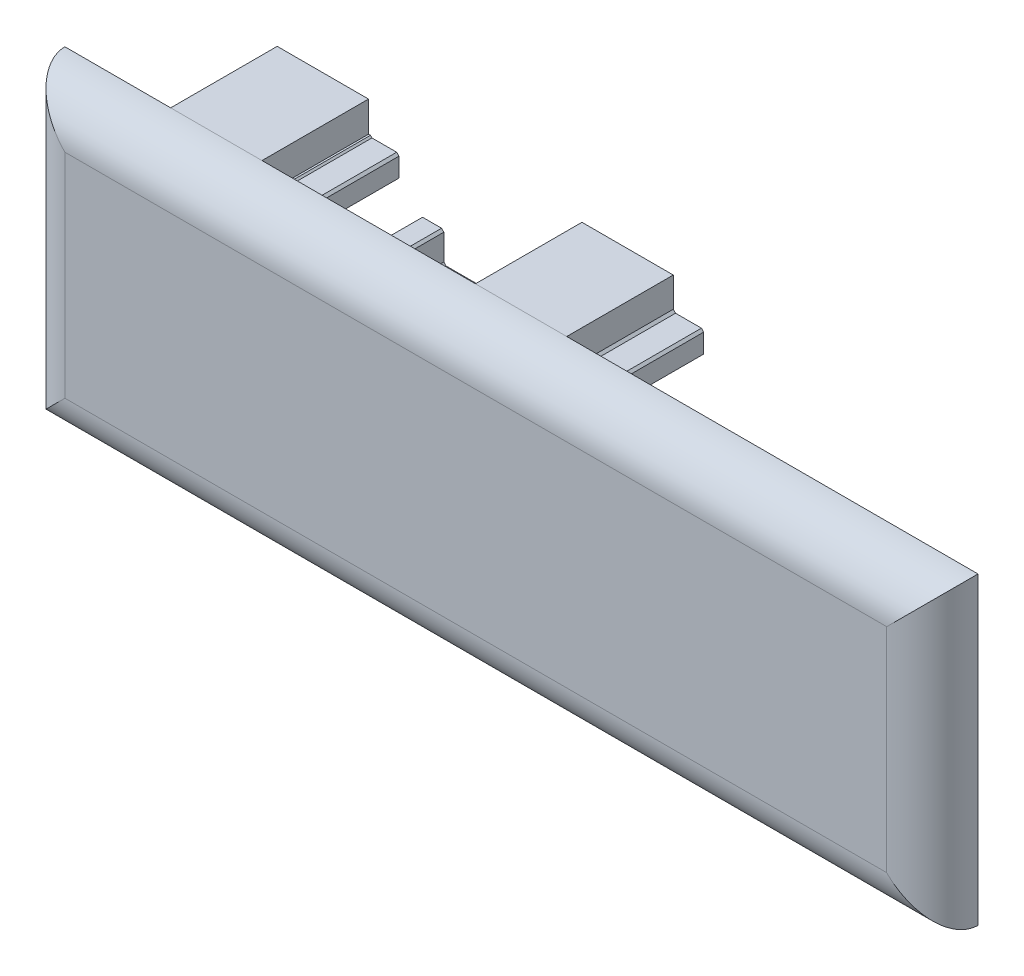
from build123d import *

# Parameters (mm, degrees)
SKETCH_1_W          = 60
SKETCH_1_H          = 20
EXTRUDE_1_DEPTH     = 3
EXTRUDE_3_DEPTH     = 7
SKETCH_5_W          = 2
SKETCH_5_H          = 0.1
SKETCH_5_W_2        = 4.2
SKETCH_5_H_2        = 2
CUT_EXTRUDE_2_DEPTH = 7
CHAMFER_1_SIZE      = 0.15
FILLET_1_R          = 3


# Some blends are built 0.0001 mm under size
with BuildPart() as part:
    # 草图1 → 凸台-拉伸1 (new body)
    with BuildSketch(Plane.XY):
        with Locations((-20, 0)):
            Rectangle(SKETCH_1_W, SKETCH_1_H)
    extrude(amount=EXTRUDE_1_DEPTH)

    # 草图1<5> → 凸台-拉伸3 (add)
    with BuildSketch(Plane.XY):
        Polygon((-17.025, 10), (-23.025, 10), (-23.025, 8), (-25.025, 8), (-25.025, 6.5), (-24.525, 6), (-15.525, 6), (-15.025, 6.5), (-15.025, 8), (-17.025, 8), align=None)
        Polygon((-37.05, 10), (-43.05, 10), (-43.05, 8), (-45.05, 8), (-45.05, 6.5), (-44.55, 6), (-35.55, 6), (-35.05, 6.5), (-35.05, 8), (-37.05, 8), align=None)
        Polygon((-26, 4.55), (-26, -4.45), (-26.5, -4.95), (-28, -4.95), (-28, -2.95), (-32, -2.95), (-32, -4.95), (-33.5, -4.95), (-34, -4.45), (-34, 4.55), (-33.5, 5.05), (-32, 5.05), (-32, 3.05), (-28, 3.05), (-28, 5.05), (-26.5, 5.05), align=None)
        Polygon((-23.025, -8), (-23.025, -10), (-17.025, -10), (-17.025, -8), (-15.025, -8), (-15.025, -6.5), (-15.525, -6), (-24.525, -6), (-25.025, -6.5), (-25.025, -8), align=None)
        Polygon((-42.95, -8), (-42.95, -10), (-36.95, -10), (-36.95, -8), (-34.95, -8), (-34.95, -6.5), (-35.45, -6), (-44.45, -6), (-44.95, -6.5), (-44.95, -8), align=None)
    extrude(amount=-EXTRUDE_3_DEPTH)

    # 草图5 → 切除-拉伸2 (cut)
    with BuildSketch(Plane(origin=(0, 0, -7), x_dir=(-1, 0, 0), z_dir=(0, 0, -1))):
        with Locations((16.025, 7.95)):
            Rectangle(SKETCH_5_W, SKETCH_5_H)
        with Locations((24.025, 7.95)):
            Rectangle(SKETCH_5_W, SKETCH_5_H)
        with Locations((35.975, 7.95)):
            Rectangle(SKETCH_5_W, SKETCH_5_H)
        with Locations((43.975, 7.95)):
            Rectangle(SKETCH_5_W, SKETCH_5_H)
        with Locations((30, 4.05)):
            Rectangle(SKETCH_5_W_2, SKETCH_5_H_2)
        with Locations((30, -4.05)):
            Rectangle(SKETCH_5_W_2, SKETCH_5_H_2)
    extrude(amount=-CUT_EXTRUDE_2_DEPTH, mode=Mode.SUBTRACT)

    # 倒角1
    # the kernel refuses this chamfer: 0.15 mm, written as the material it adds along each edge
    with BuildSketch(Plane(origin=(-32.1, -3.05, -7), x_dir=(-0.027495876610573042, -0.9996219169112971, 0), z_dir=(0, 0, 1))) as chamfer_1_piece_1_section:
        Polygon((CHAMFER_1_SIZE * 0.999621916911, CHAMFER_1_SIZE * 0.0274958766106), (-CHAMFER_1_SIZE * 0.0274958766106, CHAMFER_1_SIZE * 0.999621916911), (0, 0), align=None)
    chamfer_1_piece_1 = extrude(amount=7, mode=Mode.PRIVATE)
    chamfer_1_piece_1 = split(chamfer_1_piece_1, bisect_by=Plane(origin=(-32, -3.10460455, -3.5), z_dir=(-1, 0, 0)), keep=Keep.TOP, mode=Mode.PRIVATE)
    add(chamfer_1_piece_1)
    with BuildSketch(Plane(origin=(-32.1, -3.05, -7), x_dir=(-0.027495876610573042, -0.9996219169112971, 0), z_dir=(0, 0, 1))) as chamfer_1_piece_2_section:
        Polygon((CHAMFER_1_SIZE * 0.999621916911, CHAMFER_1_SIZE * 0.0274958766106), (-CHAMFER_1_SIZE * 0.0274958766106, CHAMFER_1_SIZE * 0.999621916911), (0, 0), align=None)
    chamfer_1_piece_2 = extrude(amount=7.385752448, mode=Mode.PRIVATE)
    chamfer_1_piece_2 = split(chamfer_1_piece_2, bisect_by=Plane(origin=(-32.060343707, -3.10460455, 0), z_dir=(0, 0, 1)), keep=Keep.TOP, mode=Mode.PRIVATE)
    chamfer_1_piece_2 = split(chamfer_1_piece_2, bisect_by=Plane(origin=(-32, -3.10460455, 0.192876224), z_dir=(-1, 0, 0)), keep=Keep.TOP, mode=Mode.PRIVATE)
    add(chamfer_1_piece_2)
    with BuildSketch(Plane(origin=(-32.1, -3.05, -7), x_dir=(-0.027495876610573042, -0.9996219169112971, 0), z_dir=(0, 0, 1))) as chamfer_1_piece_3_section:
        Polygon((CHAMFER_1_SIZE * 0.999621916911, CHAMFER_1_SIZE * 0.0274958766106), (-CHAMFER_1_SIZE * 0.0274958766106, CHAMFER_1_SIZE * 0.999621916911), (0, 0), align=None)
    chamfer_1_piece_3 = extrude(amount=7.385752448, mode=Mode.PRIVATE)
    chamfer_1_piece_3 = split(chamfer_1_piece_3, bisect_by=Plane(origin=(-31.98101474, -3.063087711, 0), z_dir=(0, 0, 1)), keep=Keep.TOP, mode=Mode.PRIVATE)
    chamfer_1_piece_3 = split(chamfer_1_piece_3, bisect_by=Plane(origin=(-32, -3.063087711, 0.192876224), z_dir=(1, 0, 0)), keep=Keep.TOP, mode=Mode.PRIVATE)
    add(chamfer_1_piece_3)
    with BuildSketch(Plane(origin=(-27.9, -3.05, -7), x_dir=(-0.9996219169112968, 0.027495876610587344, 0), z_dir=(0, 0, 1))) as chamfer_1_piece_4_section:
        Polygon((CHAMFER_1_SIZE * 0.999621916911, CHAMFER_1_SIZE * 0.0274958766106), (-CHAMFER_1_SIZE * 0.0274958766106, CHAMFER_1_SIZE * 0.999621916911), (0, 0), align=None)
    chamfer_1_piece_4 = extrude(amount=7, mode=Mode.PRIVATE)
    chamfer_1_piece_4 = split(chamfer_1_piece_4, bisect_by=Plane(origin=(-28, -3.10460455, -3.5), z_dir=(1, 0, 0)), keep=Keep.TOP, mode=Mode.PRIVATE)
    add(chamfer_1_piece_4)
    with BuildSketch(Plane(origin=(-27.9, -3.05, -7), x_dir=(-0.9996219169112968, 0.027495876610587344, 0), z_dir=(0, 0, 1))) as chamfer_1_piece_5_section:
        Polygon((CHAMFER_1_SIZE * 0.999621916911, CHAMFER_1_SIZE * 0.0274958766106), (-CHAMFER_1_SIZE * 0.0274958766106, CHAMFER_1_SIZE * 0.999621916911), (0, 0), align=None)
    chamfer_1_piece_5 = extrude(amount=7.385752448, mode=Mode.PRIVATE)
    chamfer_1_piece_5 = split(chamfer_1_piece_5, bisect_by=Plane(origin=(-28.01898526, -3.063087711, 0), z_dir=(0, 0, 1)), keep=Keep.TOP, mode=Mode.PRIVATE)
    chamfer_1_piece_5 = split(chamfer_1_piece_5, bisect_by=Plane(origin=(-28, -3.063087711, 0.192876224), z_dir=(-1, 0, 0)), keep=Keep.TOP, mode=Mode.PRIVATE)
    add(chamfer_1_piece_5)
    with BuildSketch(Plane(origin=(-27.9, -3.05, -7), x_dir=(-0.9996219169112968, 0.027495876610587344, 0), z_dir=(0, 0, 1))) as chamfer_1_piece_6_section:
        Polygon((CHAMFER_1_SIZE * 0.999621916911, CHAMFER_1_SIZE * 0.0274958766106), (-CHAMFER_1_SIZE * 0.0274958766106, CHAMFER_1_SIZE * 0.999621916911), (0, 0), align=None)
    chamfer_1_piece_6 = extrude(amount=7.385752448, mode=Mode.PRIVATE)
    chamfer_1_piece_6 = split(chamfer_1_piece_6, bisect_by=Plane(origin=(-27.939656293, -3.10460455, 0), z_dir=(0, 0, 1)), keep=Keep.TOP, mode=Mode.PRIVATE)
    chamfer_1_piece_6 = split(chamfer_1_piece_6, bisect_by=Plane(origin=(-28, -3.10460455, 0.192876224), z_dir=(1, 0, 0)), keep=Keep.TOP, mode=Mode.PRIVATE)
    add(chamfer_1_piece_6)
    with BuildSketch(Plane(origin=(-32.1, 3.05, -7), x_dir=(0.9996219169112968, -0.027495876610587344, 0), z_dir=(0, 0, 1)), Plane(origin=(-27.9, 3.05, -7), x_dir=(0.02749587661059597, 0.9996219169112964, 0), z_dir=(0, 0, 1)), Plane(origin=(-42.975, 7.9, -7), x_dir=(0.027495876610572963, 0.9996219169112971, 0), z_dir=(0, 0, 1)), Plane(origin=(-23.025, 7.9, -7), x_dir=(0.02749587661059597, 0.9996219169112964, 0), z_dir=(0, 0, 1)), Plane(origin=(-17.025, 7.9, -7), x_dir=(0.9996219169112968, -0.027495876610584464, 0), z_dir=(0, 0, 1))) as chamfer_1_piece_7:
        Polygon((CHAMFER_1_SIZE * 0.999621916911, CHAMFER_1_SIZE * 0.0274958766106), (-CHAMFER_1_SIZE * 0.0274958766106, CHAMFER_1_SIZE * 0.999621916911), (0, 0), align=None)
    extrude(amount=7.385752448)
    with BuildSketch(Plane(origin=(-36.975, 7.9, -7), x_dir=(0.9996219169112968, -0.0274958766105851, 0), z_dir=(0, 0, 1))) as chamfer_1_piece_8_section:
        Polygon((CHAMFER_1_SIZE * 0.999621916911, CHAMFER_1_SIZE * 0.0274958766106), (-CHAMFER_1_SIZE * 0.0274958766106, CHAMFER_1_SIZE * 0.999621916911), (0, 0), align=None)
    chamfer_1_piece_8 = extrude(amount=7, mode=Mode.PRIVATE)
    chamfer_1_piece_8 = split(chamfer_1_piece_8, bisect_by=Plane(origin=(-36.92039545, 8, -3.5), z_dir=(0, -1, 0)), keep=Keep.TOP, mode=Mode.PRIVATE)
    add(chamfer_1_piece_8)
    with BuildSketch(Plane(origin=(-36.975, 7.9, -7), x_dir=(0.9996219169112968, -0.0274958766105851, 0), z_dir=(0, 0, 1))) as chamfer_1_piece_9_section:
        Polygon((CHAMFER_1_SIZE * 0.999621916911, CHAMFER_1_SIZE * 0.0274958766106), (-CHAMFER_1_SIZE * 0.0274958766106, CHAMFER_1_SIZE * 0.999621916911), (0, 0), align=None)
    chamfer_1_piece_9 = extrude(amount=7.385752448, mode=Mode.PRIVATE)
    chamfer_1_piece_9 = split(chamfer_1_piece_9, bisect_by=Plane(origin=(-36.92039545, 7.939656293, 0), z_dir=(0, 0, 1)), keep=Keep.TOP, mode=Mode.PRIVATE)
    chamfer_1_piece_9 = split(chamfer_1_piece_9, bisect_by=Plane(origin=(-36.92039545, 8, 0.192876224), z_dir=(0, -1, 0)), keep=Keep.TOP, mode=Mode.PRIVATE)
    add(chamfer_1_piece_9)
    with BuildSketch(Plane(origin=(-36.975, 7.9, -7), x_dir=(0.9996219169112968, -0.0274958766105851, 0), z_dir=(0, 0, 1))) as chamfer_1_piece_10_section:
        Polygon((CHAMFER_1_SIZE * 0.999621916911, CHAMFER_1_SIZE * 0.0274958766106), (-CHAMFER_1_SIZE * 0.0274958766106, CHAMFER_1_SIZE * 0.999621916911), (0, 0), align=None)
    chamfer_1_piece_10 = extrude(amount=7.385752448, mode=Mode.PRIVATE)
    chamfer_1_piece_10 = split(chamfer_1_piece_10, bisect_by=Plane(origin=(-36.961912289, 8.01898526, 0), z_dir=(0, 0, 1)), keep=Keep.TOP, mode=Mode.PRIVATE)
    chamfer_1_piece_10 = split(chamfer_1_piece_10, bisect_by=Plane(origin=(-36.961912289, 8, 0.192876224), z_dir=(0, 1, 0)), keep=Keep.TOP, mode=Mode.PRIVATE)
    add(chamfer_1_piece_10)
    with BuildSketch(Plane(origin=(-36.95, -8, 0.385752448), x_dir=(-0.027495876610572963, -0.9996219169112971, 0), z_dir=(0, 0, -1)), Plane(origin=(-42.95, -8, 0.385752448), x_dir=(-0.9996219169112968, 0.0274958766105851, 0), z_dir=(0, 0, -1)), Plane(origin=(-17.025, -8, 0.385752448), x_dir=(-0.02749587661059597, -0.9996219169112964, 0), z_dir=(0, 0, -1)), Plane(origin=(-23.025, -8, 0.385752448), x_dir=(-0.9996219169112968, 0.027495876610584464, 0), z_dir=(0, 0, -1))) as chamfer_1_piece_11:
        Polygon((CHAMFER_1_SIZE * 0.999621916911, -CHAMFER_1_SIZE * 0.0274958766106), (-CHAMFER_1_SIZE * 0.0274958766106, -CHAMFER_1_SIZE * 0.999621916911), (0, 0), align=None)
    extrude(amount=7.385752448)
    # the kernel refuses this chamfer: 0.15 mm, written as the material it takes off along each edge
    with BuildSketch(Plane(origin=(-32.1, -4.95, -7.385752448), x_dir=(-0.9996219169112968, -0.0274958766105851, 0), z_dir=(0, 0, 1)), Plane(origin=(-32.1, 5.05, -7.385752448), x_dir=(0.027495876610572963, -0.9996219169112971, 0), z_dir=(0, 0, 1)), Plane(origin=(-27.9, 5.05, -7.385752448), x_dir=(0.9996219169112968, 0.027495876610584464, 0), z_dir=(0, 0, 1)), Plane(origin=(-25.025, 7.9, -7.385752448), x_dir=(0.9996219169112968, 0.027495876610584464, 0), z_dir=(0, 0, 1)), Plane(origin=(-35.05, 7.9, -7.385752448), x_dir=(0.027495876610572963, -0.9996219169112971, 0), z_dir=(0, 0, 1)), Plane(origin=(-15.025, 7.9, -7.385752448), x_dir=(0.027495876610584464, -0.9996219169112968, 0), z_dir=(0, 0, 1))) as chamfer_1_2_piece_1:
        Polygon((CHAMFER_1_SIZE * 0.999621916911, -CHAMFER_1_SIZE * 0.0274958766106), (-CHAMFER_1_SIZE * 0.0274958766106, -CHAMFER_1_SIZE * 0.999621916911), (0, 0), align=None)
    extrude(amount=7.385752448, mode=Mode.SUBTRACT)
    with BuildSketch(Plane(origin=(-27.9, -4.95, 0), x_dir=(-0.02749587661059597, 0.9996219169112964, 0), z_dir=(0, 0, -1)), Plane(origin=(-34.95, -8, 0), x_dir=(-0.9996219169112968, -0.0274958766105851, 0), z_dir=(0, 0, -1)), Plane(origin=(-44.95, -8, 0), x_dir=(-0.027495876610572963, 0.9996219169112971, 0), z_dir=(0, 0, -1)), Plane(origin=(-15.025, -8, 0), x_dir=(-0.9996219169112968, -0.027495876610584464, 0), z_dir=(0, 0, -1)), Plane(origin=(-25.025, -8, 0), x_dir=(-0.02749587661059597, 0.9996219169112964, 0), z_dir=(0, 0, -1))) as chamfer_1_2_piece_2:
        Polygon((CHAMFER_1_SIZE * 0.999621916911, CHAMFER_1_SIZE * 0.0274958766106), (-CHAMFER_1_SIZE * 0.0274958766106, CHAMFER_1_SIZE * 0.999621916911), (0, 0), align=None)
    extrude(amount=7.385752448, mode=Mode.SUBTRACT)

    # 圆角1
    fillet_1_edges = [part.edges().sort_by_distance(p)[0] for p in [
        (10, 0, 3),
        (-20, -10, 3),
        (-20, 10, 3),
        (-50, 0, 3),
    ]]
    fillet(fillet_1_edges, radius=FILLET_1_R - 0.0001)  # a hair under: the kernel refuses the full size


solid = part.part
